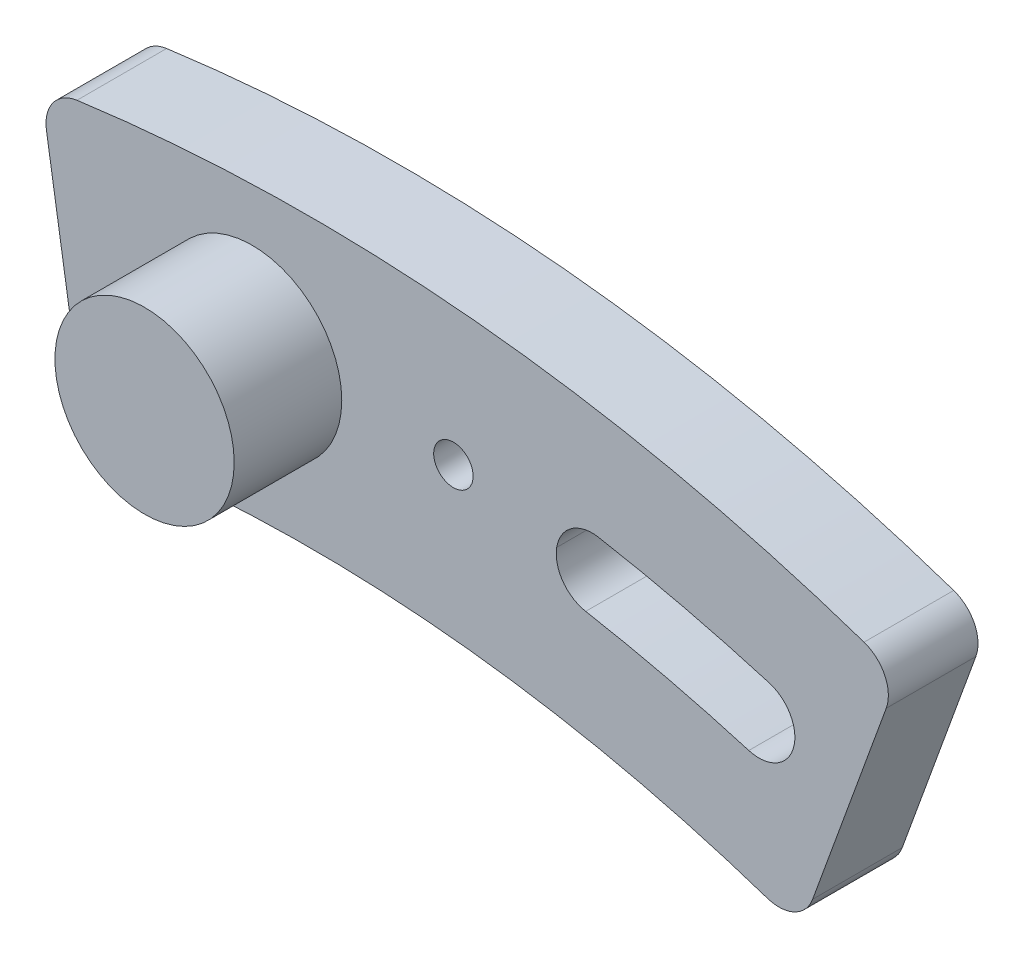
from build123d import *

# Parameters (mm, degrees)
BOSS_EXTRUDE1_DEPTH = 5
SKETCH1_13_R        = 1.1
CUT_EXTRUDE2_DEPTH  = 10
FILLET1_R           = 2
BOSS_EXTRUDE2_DEPTH = 11


with BuildPart() as part:
    # Sketch1 → Boss-Extrude1 (new body)
    with BuildSketch(Plane.XY):
        with BuildLine():
            Line((27.361611466, 75.175409663), (32.833933759, 90.210491595))
            ThreePointArc((32.833933759, 90.210491595), (9.201192242, 95.558035043), (-15.017708644, 94.818080697))
            Line((-15.017708644, 94.818080697), (-12.514757203, 79.015067248))
            ThreePointArc((-12.514757203, 79.015067248), (7.667660202, 79.631695869), (27.361611466, 75.175409663))
        make_face()
    extrude(amount=BOSS_EXTRUDE1_DEPTH)

    # Sketch1<13> → Cut-Extrude2 (cut)
    with BuildSketch(Plane.XY):
        with BuildLine():
            ThreePointArc((13.453363993, 84.941197291), (19.959187303, 83.651843029), (26.346302102, 81.864964213))
            Line((26.346302102, 81.864964213), (27.571711502, 85.672636967))
            ThreePointArc((27.571711502, 85.672636967), (20.887521597, 87.542626426), (14.079101854, 88.891950654))
            Line((14.079101854, 88.891950654), (13.453363993, 84.941197291))
        make_face()
        with Locations((8, 88)):
            Circle(SKETCH1_13_R)
    extrude(amount=CUT_EXTRUDE2_DEPTH, mode=Mode.SUBTRACT)

    # Fillet1
    fillet1_edges = [part.edges().sort_by_distance(p)[0] for p in [
        (26.346302102, 81.864964213, 2.5),
        (27.571711502, 85.672636967, 2.5),
        (14.079101854, 88.891950654, 2.5),
        (13.453363993, 84.941197291, 2.5),
        (-12.514757203, 79.015067248, 2.5),
        (-15.017708644, 94.818080697, 2.5),
        (27.361611466, 75.175409663, 2.5),
        (32.833933759, 90.210491595, 2.5),
    ]]
    fillet(fillet1_edges, radius=FILLET1_R - 0.0001)  # a hair under: the kernel refuses the full size

    # Sketch1<14> → Boss-Extrude2 (add)
    with BuildSketch(Plane.XY):
        with BuildLine():
            ThreePointArc((-0.5, 92.19088917), (-8.226985142, 88), (-0.5, 83.80911083))
            Line((-0.5, 83.80911083), (-0.5, 92.19088917))
        make_face()
        with BuildLine():
            Line((-0.5, 92.19088917), (-0.5, 83.80911083))
            ThreePointArc((-0.5, 83.80911083), (1.168178433, 85.616192721), (1.773014858, 88))
            ThreePointArc((1.773014858, 88), (1.168178433, 90.383807279), (-0.5, 92.19088917))
        make_face()
    extrude(amount=BOSS_EXTRUDE2_DEPTH)


solid = part.part
